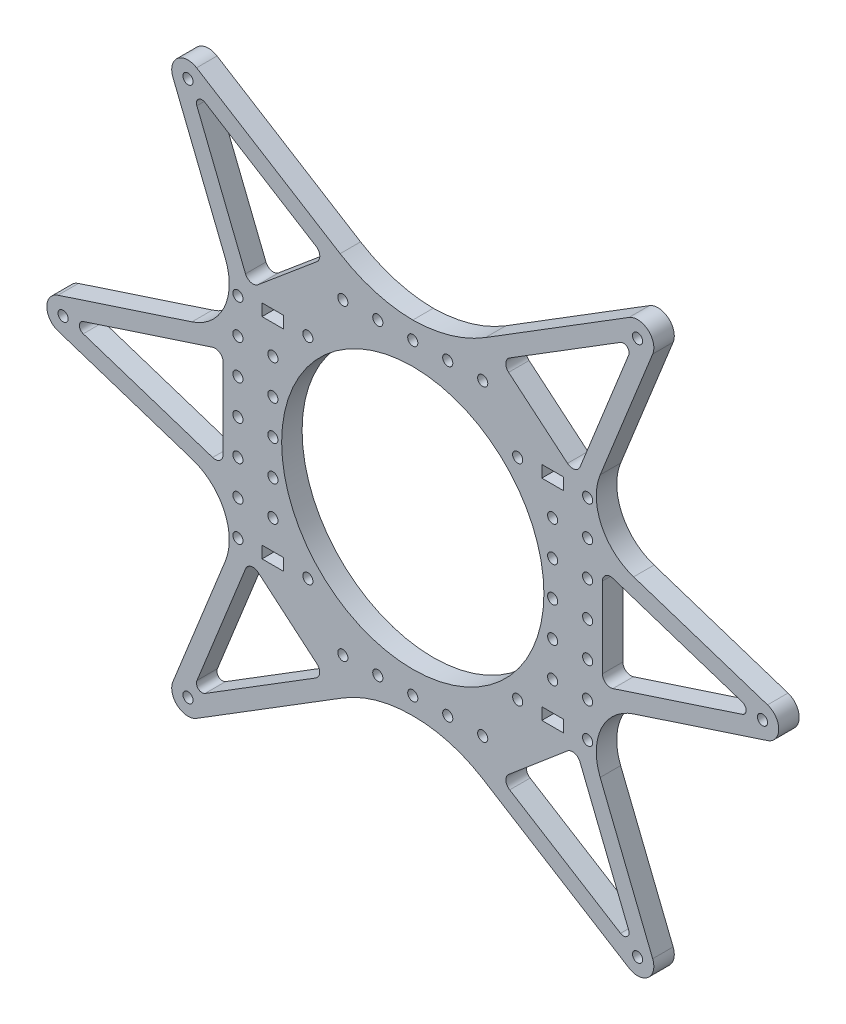
from build123d import *

# Parameters (mm, degrees)
SKETCH1_R           = 1.450000006
SKETCH1_R_2         = 1.45
SKETCH1_R_3         = 37.5
SKETCH1_W           = 6.2
SKETCH1_H           = 3.4
BOSS_EXTRUDE1_DEPTH = 5.85


with BuildPart() as part:
    # Sketch1 → Boss-Extrude1 (new body)
    with BuildSketch(Plane.XY):
        with BuildLine():
            Line((587.995290395, 497.753361998), (603.001149052, 460.347016836))
            ThreePointArc((603.001149052, 460.347016836), (602.663461243, 448.032016356), (593.446685098, 439.857402764))
            Line((593.446685098, 439.857402764), (555.146182231, 427.30822221))
            ThreePointArc((555.146182231, 427.30822221), (551.939243509, 422.882775531), (555.146182231, 418.457328853))
            Line((555.146182231, 418.457328853), (593.451704621, 405.906503648))
            ThreePointArc((593.451704621, 405.906503648), (602.672646523, 397.727172938), (603.008211739, 385.405865524))
            Line((603.008211739, 385.405865524), (587.996899243, 348.012788825))
            ThreePointArc((587.996899243, 348.012788825), (589.323611121, 342.712892318), (594.773109373, 342.32297413))
            Line((594.773109373, 342.32297413), (636.531879216, 368.248955529))
            ThreePointArc((636.531879216, 368.248955529), (646.164378733, 372.489187309), (656.596182238, 373.882775531))
            ThreePointArc((656.596182238, 373.882775531), (667.027985743, 372.489187309), (676.66048526, 368.248955529))
            Line((676.66048526, 368.248955529), (718.419255103, 342.32297413))
            ThreePointArc((718.419255103, 342.32297413), (723.868753355, 342.712892318), (725.195465233, 348.012788825))
            Line((725.195465233, 348.012788825), (710.184152737, 385.405865524))
            ThreePointArc((710.184152737, 385.405865524), (710.519717953, 397.727172938), (719.740659854, 405.906503648))
            Line((719.740659854, 405.906503648), (758.046182244, 418.457328853))
            ThreePointArc((758.046182244, 418.457328853), (761.253120966, 422.882775531), (758.046182244, 427.30822221))
            Line((758.046182244, 427.30822221), (719.745679378, 439.857402764))
            ThreePointArc((719.745679378, 439.857402764), (710.528903233, 448.032016356), (710.191215423, 460.347016836))
            Line((710.191215423, 460.347016836), (725.197074081, 497.753361998))
            ThreePointArc((725.197074081, 497.753361998), (723.86836572, 503.054641878), (718.416896408, 503.442606583))
            Line((718.416896408, 503.442606583), (677.369935548, 477.934266348))
            ThreePointArc((677.369935548, 477.934266348), (667.39800528, 473.484079569), (656.596182238, 471.882775531))
            ThreePointArc((656.596182238, 471.882775531), (645.794359196, 473.484079569), (635.822428927, 477.934266348))
            Line((635.822428927, 477.934266348), (594.775468067, 503.442606583))
            ThreePointArc((594.775468067, 503.442606583), (589.323998755, 503.054641878), (587.995290395, 497.753361998))
        make_face()
        with Locations((592.317421269, 499.487219843)):
            Circle(SKETCH1_R, mode=Mode.SUBTRACT)
        with Locations((706.596182238, 432.882775531)):
            Circle(SKETCH1_R_2, mode=Mode.SUBTRACT)
        with Locations((706.596182238, 442.882775531)):
            Circle(SKETCH1_R_2, mode=Mode.SUBTRACT)
        with Locations((706.596182238, 452.882775531)):
            Circle(SKETCH1_R_2, mode=Mode.SUBTRACT)
        with Locations((706.596182238, 392.882775531)):
            Circle(SKETCH1_R_2, mode=Mode.SUBTRACT)
        with Locations((556.596182238, 422.882775531)):
            Circle(SKETCH1_R, mode=Mode.SUBTRACT)
        with Locations((646.596182238, 378.882775531)):
            Circle(SKETCH1_R_2, mode=Mode.SUBTRACT)
        with Locations((656.596182238, 422.882775531)):
            Circle(SKETCH1_R_3, mode=Mode.SUBTRACT)
        with Locations((636.596182238, 378.882775531)):
            Circle(SKETCH1_R_2, mode=Mode.SUBTRACT)
        with Locations((706.596182238, 402.882775531)):
            Circle(SKETCH1_R_2, mode=Mode.SUBTRACT)
        with Locations((656.596182238, 466.882775531)):
            Circle(SKETCH1_R_2, mode=Mode.SUBTRACT)
        with Locations((696.596182238, 432.882775531)):
            Circle(SKETCH1_R_2, mode=Mode.SUBTRACT)
        with Locations((592.317421269, 346.278331219)):
            Circle(SKETCH1_R, mode=Mode.SUBTRACT)
        with Locations((706.596182238, 412.882775531)):
            Circle(SKETCH1_R_2, mode=Mode.SUBTRACT)
        with Locations((656.596182238, 378.882775531)):
            Circle(SKETCH1_R_2, mode=Mode.SUBTRACT)
        with Locations((696.596182238, 442.882775531)):
            Circle(SKETCH1_R_2, mode=Mode.SUBTRACT)
        with Locations((696.596182238, 402.882775531)):
            Circle(SKETCH1_R_2, mode=Mode.SUBTRACT)
        with Locations((696.596182238, 412.882775531)):
            Circle(SKETCH1_R_2, mode=Mode.SUBTRACT)
        with Locations((646.596182238, 466.882775531)):
            Circle(SKETCH1_R_2, mode=Mode.SUBTRACT)
        with Locations((636.596182238, 466.882775531)):
            Circle(SKETCH1_R_2, mode=Mode.SUBTRACT)
        with Locations((696.596182238, 422.882775531)):
            Circle(SKETCH1_R_2, mode=Mode.SUBTRACT)
        with Locations((676.596182238, 466.882775531)):
            Circle(SKETCH1_R_2, mode=Mode.SUBTRACT)
        with Locations((666.596182238, 466.882775531)):
            Circle(SKETCH1_R_2, mode=Mode.SUBTRACT)
        with Locations((706.596182238, 422.882775531)):
            Circle(SKETCH1_R_2, mode=Mode.SUBTRACT)
        with Locations((686.596182238, 452.882775531)):
            Circle(SKETCH1_R_2, mode=Mode.SUBTRACT)
        with Locations((686.596182238, 392.882775531)):
            Circle(SKETCH1_R_2, mode=Mode.SUBTRACT)
        with Locations((626.596182238, 392.882775531)):
            Circle(SKETCH1_R_2, mode=Mode.SUBTRACT)
        with Locations((720.874943207, 346.278331219)):
            Circle(SKETCH1_R, mode=Mode.SUBTRACT)
        with Locations((676.596182238, 378.882775531)):
            Circle(SKETCH1_R_2, mode=Mode.SUBTRACT)
        with Locations((666.596182238, 378.882775531)):
            Circle(SKETCH1_R_2, mode=Mode.SUBTRACT)
        with Locations((756.596182238, 422.882775531)):
            Circle(SKETCH1_R, mode=Mode.SUBTRACT)
        with Locations((626.596182238, 452.882775531)):
            Circle(SKETCH1_R_2, mode=Mode.SUBTRACT)
        with Locations((606.596182238, 422.882775531)):
            Circle(SKETCH1_R_2, mode=Mode.SUBTRACT)
        with Locations((616.596182238, 422.882775531)):
            Circle(SKETCH1_R_2, mode=Mode.SUBTRACT)
        with Locations((616.596182238, 412.882775531)):
            Circle(SKETCH1_R_2, mode=Mode.SUBTRACT)
        with Locations((720.874943207, 499.487219843)):
            Circle(SKETCH1_R, mode=Mode.SUBTRACT)
        with Locations((616.596182238, 402.882775531)):
            Circle(SKETCH1_R_2, mode=Mode.SUBTRACT)
        with Locations((616.596182238, 442.882775531)):
            Circle(SKETCH1_R_2, mode=Mode.SUBTRACT)
        with Locations((606.596182238, 412.882775531)):
            Circle(SKETCH1_R_2, mode=Mode.SUBTRACT)
        with Locations((616.596182238, 432.882775531)):
            Circle(SKETCH1_R_2, mode=Mode.SUBTRACT)
        with Locations((606.596182238, 402.882775531)):
            Circle(SKETCH1_R_2, mode=Mode.SUBTRACT)
        with Locations((606.596182238, 392.882775531)):
            Circle(SKETCH1_R_2, mode=Mode.SUBTRACT)
        with Locations((606.596182238, 452.882775531)):
            Circle(SKETCH1_R_2, mode=Mode.SUBTRACT)
        with Locations((606.596182238, 442.882775531)):
            Circle(SKETCH1_R_2, mode=Mode.SUBTRACT)
        with Locations((606.596182238, 432.882775531)):
            Circle(SKETCH1_R_2, mode=Mode.SUBTRACT)
        with BuildLine():
            Line((594.852213644, 494.089955534), (608.761050105, 459.418248349))
            ThreePointArc((608.761050105, 459.418248349), (610.328090614, 458.05093997), (612.354775393, 458.517520045))
            Line((612.354775393, 458.517520045), (629.185249241, 472.639964443))
            ThreePointArc((629.185249241, 472.639964443), (629.996671034, 474.554838547), (628.922248871, 476.335502797))
            Line((628.922248871, 476.335502797), (597.192526929, 496.053711548))
            ThreePointArc((597.192526929, 496.053711548), (595.310843783, 495.919797808), (594.852213644, 494.089955534))
        make_face(mode=Mode.SUBTRACT)
        with Locations((696.596182238, 392.882775531)):
            Rectangle(SKETCH1_W, SKETCH1_H, mode=Mode.SUBTRACT)
        with BuildLine():
            Line((562.360059701, 421.35524452), (599.360059701, 409.232174436))
            ThreePointArc((599.360059701, 409.232174436), (601.41475291, 409.553708225), (602.360059701, 411.406150729))
            Line((602.360059701, 411.406150729), (602.360059701, 434.359400333))
            ThreePointArc((602.360059701, 434.359400333), (601.41475291, 436.211842837), (599.360059701, 436.533376627))
            Line((599.360059701, 436.533376627), (562.360059701, 424.410306542))
            ThreePointArc((562.360059701, 424.410306542), (561.253120966, 422.882775531), (562.360059701, 421.35524452))
        make_face(mode=Mode.SUBTRACT)
        with BuildLine():
            Line((594.897239667, 351.78038038), (608.794032765, 386.397196889))
            ThreePointArc((608.794032765, 386.397196889), (610.36130643, 387.761102695), (612.3843749, 387.288049044))
            Line((612.3843749, 387.288049044), (629.156141394, 373.086154531))
            ThreePointArc((629.156141394, 373.086154531), (629.961681006, 371.166639364), (628.883661612, 369.385823055))
            Line((628.883661612, 369.385823055), (597.19261369, 349.710398658))
            ThreePointArc((597.19261369, 349.710398658), (595.266724956, 349.882452422), (594.897239667, 351.78038038))
        make_face(mode=Mode.SUBTRACT)
        with Locations((616.596182238, 452.882775531)):
            Rectangle(SKETCH1_W, SKETCH1_H, mode=Mode.SUBTRACT)
        with Locations((696.596182238, 452.882775531)):
            Rectangle(SKETCH1_W, SKETCH1_H, mode=Mode.SUBTRACT)
        with BuildLine():
            Line((715.999750786, 349.710398658), (684.308702864, 369.385823055))
            ThreePointArc((684.308702864, 369.385823055), (683.230683469, 371.166639364), (684.036223082, 373.086154531))
            Line((684.036223082, 373.086154531), (700.807989576, 387.288049044))
            ThreePointArc((700.807989576, 387.288049044), (702.831058046, 387.761102695), (704.39833171, 386.397196889))
            Line((704.39833171, 386.397196889), (718.295124809, 351.78038038))
            ThreePointArc((718.295124809, 351.78038038), (717.92563952, 349.882452422), (715.999750786, 349.710398658))
        make_face(mode=Mode.SUBTRACT)
        with BuildLine():
            Line((750.832304774, 424.410306542), (713.832304774, 436.533376627))
            ThreePointArc((713.832304774, 436.533376627), (711.777611566, 436.211842837), (710.832304774, 434.359400333))
            Line((710.832304774, 434.359400333), (710.832304774, 411.406150729))
            ThreePointArc((710.832304774, 411.406150729), (711.777611565, 409.553708225), (713.832304774, 409.232174436))
            Line((713.832304774, 409.232174436), (750.832304774, 421.35524452))
            ThreePointArc((750.832304774, 421.35524452), (751.939243509, 422.882775531), (750.832304774, 424.410306542))
        make_face(mode=Mode.SUBTRACT)
        with BuildLine():
            Line((684.007115235, 472.639964443), (700.837589083, 458.517520045))
            ThreePointArc((700.837589083, 458.517520045), (702.864273862, 458.05093997), (704.431314371, 459.418248349))
            Line((704.431314371, 459.418248349), (718.340150832, 494.089955534))
            ThreePointArc((718.340150832, 494.089955534), (717.881520693, 495.919797808), (715.999837547, 496.053711548))
            Line((715.999837547, 496.053711548), (684.270115605, 476.335502797))
            ThreePointArc((684.270115605, 476.335502797), (683.195693441, 474.554838547), (684.007115235, 472.639964443))
        make_face(mode=Mode.SUBTRACT)
        with Locations((616.596182238, 392.882775531)):
            Rectangle(SKETCH1_W, SKETCH1_H, mode=Mode.SUBTRACT)
    extrude(amount=BOSS_EXTRUDE1_DEPTH)


solid = part.part
